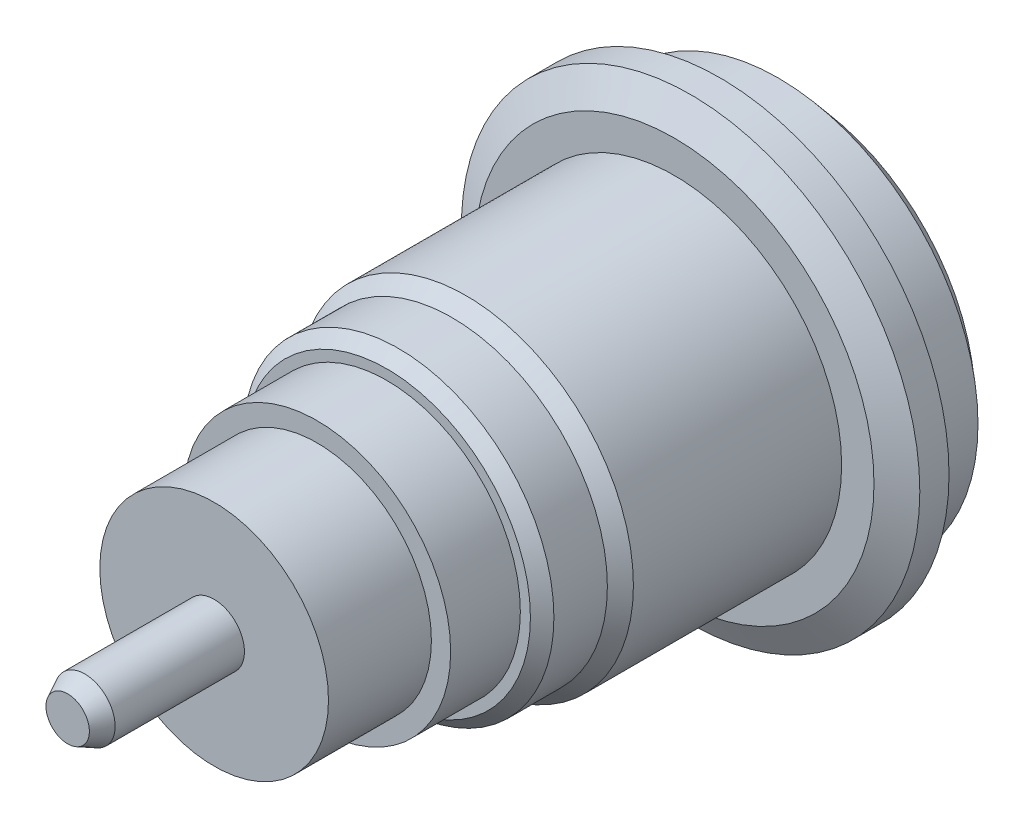
from build123d import *

# Parameters (mm, degrees)
SKETCH6_R          = 6.864817117
CUT_EXTRUDE2_DEPTH = 3.3
SKETCH5_R          = 50.459472618
CUT_EXTRUDE1_DEPTH = 25


with BuildPart() as part:
    # Sketch1 → Revolve2 (revolve)
    with BuildSketch(Plane(origin=(0, 0, 0), x_dir=(0, 0, -1), z_dir=(1, 0, 0))):
        with BuildLine():
            Line((1.771e-06, 9.5), (1.771e-06, 7.445611339))
            Line((1.771e-06, 7.445611339), (-0.771464581, 7.445611339))
            Line((-0.771464581, 7.445611339), (-0.771464581, 6.864817117))
            Line((-0.771464581, 6.864817117), (-4.066354879, 6.864817117))
            Line((-4.066354879, 6.864817117), (-4.066354879, 8.484339467))
            Line((-4.066354879, 8.484339467), (-4.975618005, 9.546154997))
            Line((-4.975618005, 9.546154997), (-7.06424338, 9.546154997))
            Line((-7.06424338, 9.546154997), (-7.767897919, 10.954193429))
            Line((-7.767897919, 10.954193429), (-9.164037876, 10.954193429))
            Line((-9.164037876, 10.954193429), (-9.945876251, 9.546154997))
            Line((-9.945876251, 9.546154997), (-9.945876251, 8))
            Line((-9.945876251, 8), (-19.896053439, 8))
            Line((-19.896053439, 8), (-20.566354879, 7.426001631))
            Line((-20.566354879, 7.426001631), (-23.121440557, 7.426001631))
            Line((-23.121440557, 7.426001631), (-23.682625072, 6.864817117))
            Line((-23.682625072, 6.864817117), (-23.682625072, 6.383537324))
            Line((-23.682625072, 6.383537324), (-27.0133813, 6.383537324))
            Line((-27.0133813, 6.383537324), (-27.0133813, 5.464238658))
            Line((-27.0133813, 5.464238658), (-31.931960755, 5.464238658))
            Line((-31.931960755, 5.464238658), (-31.931960755, 1.447456583))
            Line((-31.931960755, 1.447456583), (-38.111348046, 1.447456583))
            Line((-38.111348046, 1.447456583), (-38.931960755, 1.037362766))
            Line((-38.931960755, 1.037362766), (-38.931960755, 0))
            Line((-38.931960755, 0), (2.933645121, 0))
            ThreePointArc((2.933645121, 0), (2.489100327, 4.831124101), (1.170397182, 9.5))
            Line((1.170397182, 9.5), (1.771e-06, 9.5))
        make_face()
    revolve(axis=Axis((0, 0, 38.931960755), (0, 0, -1)))


with BuildPart() as body_2:
    # Split1: the piece on the far side of the plane
    add(part.part)
    split(bisect_by=Plane(origin=(0, 6.864817117, 4.066354879), x_dir=(1, 0, 0), z_dir=(0, 0, 1)), keep=Keep.BOTTOM)

    # Sketch5 → Cut-Extrude1 (cut)
    with BuildSketch(Plane(origin=(0, 0, 4.066354879), x_dir=(-1, 0, 0), z_dir=(0, 0, -1))):
        Circle(SKETCH5_R)
    extrude(amount=CUT_EXTRUDE1_DEPTH, mode=Mode.SUBTRACT)


with BuildPart() as part_1:
    add(part.part)

    # Split1
    split(bisect_by=Plane(origin=(0, 6.864817117, 4.066354879), x_dir=(1, 0, 0), z_dir=(0, 0, 1)), keep=Keep.TOP)

    # Sketch6 → Cut-Extrude2 (cut)
    with BuildSketch(Plane(origin=(0, 0, 4.066354879), x_dir=(-1, 0, 0), z_dir=(0, 0, -1))):
        Circle(SKETCH6_R)
    extrude(amount=-CUT_EXTRUDE2_DEPTH, mode=Mode.SUBTRACT)


solid = part_1.part
